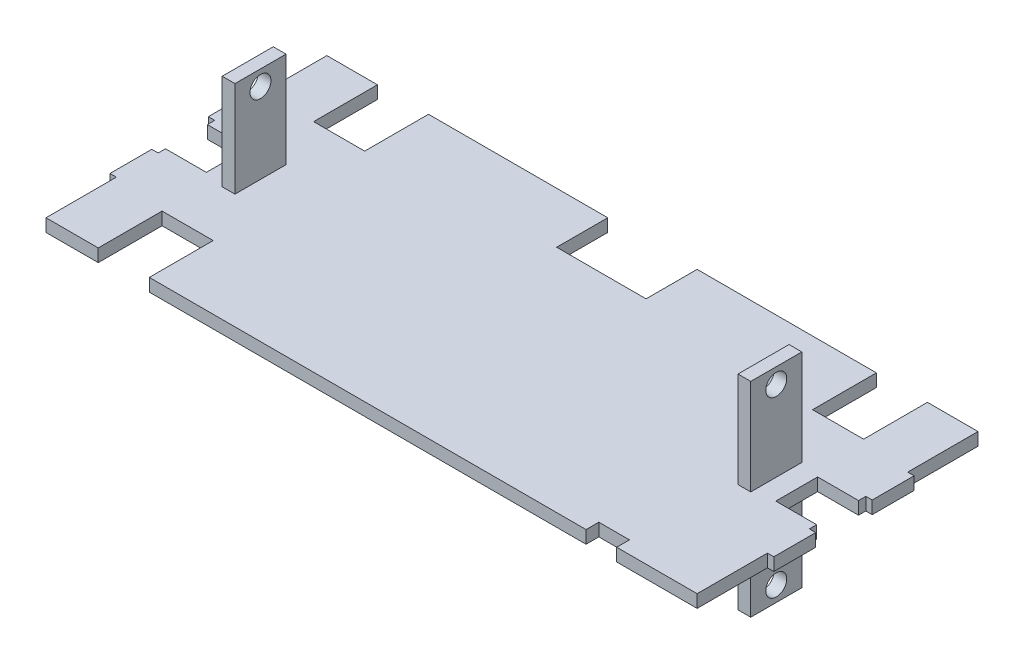
from build123d import *

# Parameters (mm, degrees)
BOSS_EXTRUDE1_DEPTH     = 3.175
SKETCH2_W               = 6.35
SKETCH2_H               = 25.4
BOSS_EXTRUDE2_DEPTH     = 50.8
CUT_EXTRUDE1_DEPTH      = 309.866637119
CUT_EXTRUDE1_DEPTH_BACK = 309.866637119
SKETCH3_R               = 5.207


with BuildPart() as part:
    # Sketch1 → Boss-Extrude1 (new, symmetric)
    with BuildSketch(Plane(origin=(0, 0, 0), x_dir=(1, 0, 0), z_dir=(0, 1, 0))):
        Polygon((161.925, -69.85), (121.92, -69.85), (121.92, -63.5), (106.68, -63.5), (106.68, -69.85), (-106.68, -69.85), (-110.5408, -69.85), (-110.5408, -38.1), (-135.9408, -38.1), (-135.9408, -69.85), (-161.925, -69.85), (-161.925, -34.874677354), (-165.1, -34.874677354), (-165.1, -14.046677354), (-161.925, -14.046677354), (-161.925, -10.414), (-141.605, -10.414), (-141.605, 10.414), (-161.925, 10.414), (-161.925, 14.046677354), (-165.1, 14.046677354), (-165.1, 34.874677354), (-161.925, 34.874677354), (-161.925, 69.85), (-136.779, 69.85), (-136.779, 38.1), (-111.379, 38.1), (-111.379, 69.85), (-22.228595254, 69.85), (-22.228595254, 44.45), (22.228595254, 44.45), (22.228595254, 69.85), (111.379, 69.85), (111.379, 38.1), (136.779, 38.1), (136.779, 69.85), (161.925, 69.85), (161.925, 34.874677354), (165.1, 34.874677354), (165.1, 14.046677354), (161.925, 14.046677354), (161.925, 10.414), (141.605, 10.414), (141.605, -10.414), (161.925, -10.414), (161.925, -14.046677354), (165.1, -14.046677354), (165.1, -34.874677354), (161.925, -34.874677354), align=None)
    extrude(amount=BOSS_EXTRUDE1_DEPTH, both=True)

    # Sketch2 → Boss-Extrude2 (add, symmetric)
    with BuildSketch(Plane(origin=(0, 0, 0), x_dir=(1, 0, 0), z_dir=(0, 1, 0))):
        with Locations((128.27, 0)):
            Rectangle(SKETCH2_W, SKETCH2_H)
        with Locations((-128.27, 0)):
            Rectangle(SKETCH2_W, SKETCH2_H)
    extrude(amount=BOSS_EXTRUDE2_DEPTH, both=True)

    # Sketch3 → Cut-Extrude1 (cut, two sides: drawn at the far end of the back side and taken through both)
    with BuildSketch(Plane.ZY.offset(131.445).offset(-CUT_EXTRUDE1_DEPTH_BACK)):
        with Locations((0, 43.18)):
            Circle(SKETCH3_R)
        with Locations((0, -43.18)):
            Circle(SKETCH3_R)
    extrude(amount=CUT_EXTRUDE1_DEPTH + CUT_EXTRUDE1_DEPTH_BACK, mode=Mode.SUBTRACT)


solid = part.part
